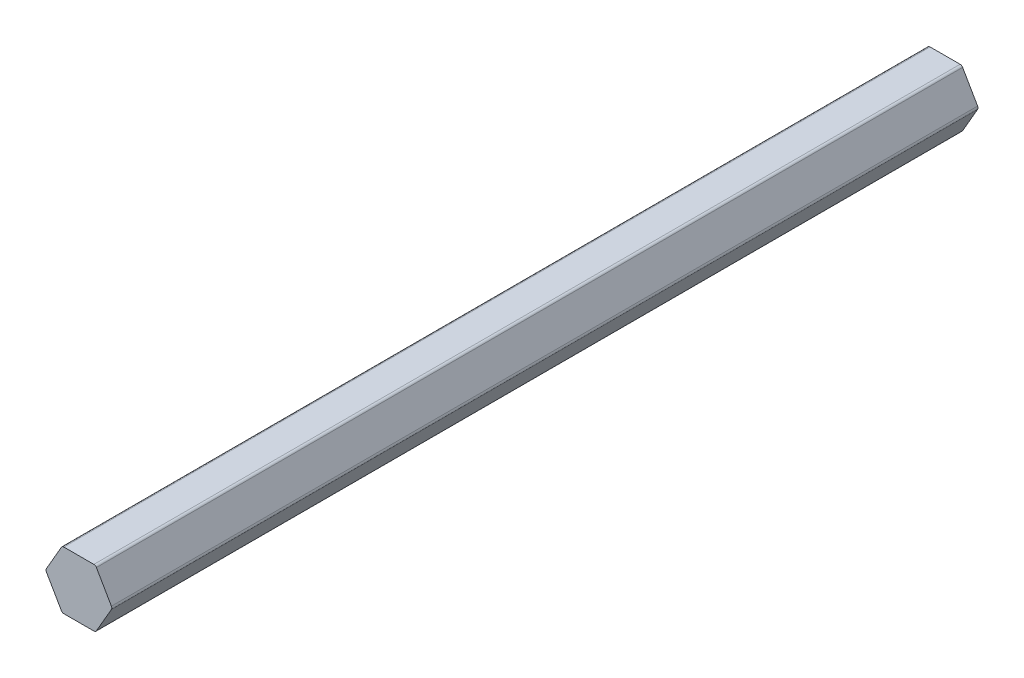
from build123d import *

# Parameters (mm, degrees)
BOSS_EXTRUDE1_DEPTH = 95.25
FILLET1_R           = 0.635


with BuildPart() as part:
    # Sketch1 → Boss-Extrude1 (new, symmetric)
    with BuildSketch(Plane.XY):
        Polygon((7.332348419, 0), (3.666174209, 6.35), (-3.666174209, 6.35), (-7.332348419, 0), (-3.666174209, -6.35), (3.666174209, -6.35), align=None)
    extrude(amount=BOSS_EXTRUDE1_DEPTH, both=True)

    # Fillet1
    fillet1_edges = [part.edges().sort_by_distance(p)[0] for p in [
        (3.666174209, -6.35, 0),
        (-3.666174209, -6.35, 0),
        (-7.332348419, 0, 0),
        (-3.666174209, 6.35, 0),
        (7.332348419, 0, 0),
        (3.666174209, 6.35, 0),
    ]]
    fillet(fillet1_edges, radius=FILLET1_R)


solid = part.part
